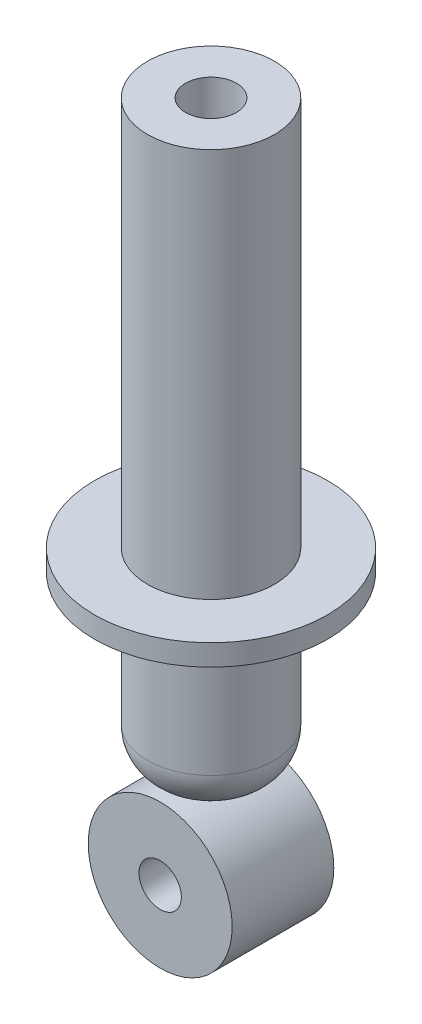
from build123d import *

# Parameters (mm, degrees)
SKETCH_1_R          = 15
EXTRUDE_1_DEPTH     = 136
SKETCH_2_R          = 15
SKETCH_2_R_2        = 6
EXTRUDE_2_DEPTH     = 2
CUT_EXTRUDE_START   = -130
SKETCH_3_R          = 6
CUT_EXTRUDE_1_DEPTH = 130
SKETCH_4_R          = 17
SKETCH_4_R_2        = 5
EXTRUDE_3_DEPTH     = 12
FILLET_1_R          = 10
SKETCH_6_R          = 27.5
SKETCH_6_R_2        = 15
EXTRUDE_4_DEPTH     = 5


with BuildPart() as part:
    # Эскиз1 → Бобышка-Вытянуть1 (new body)
    with BuildSketch(Plane(origin=(0, 0, 0), x_dir=(1, 0, 0), z_dir=(0, 1, 0))):
        Circle(SKETCH_1_R)
    extrude(amount=EXTRUDE_1_DEPTH)

    # Эскиз2 → Бобышка-Вытянуть2 (add)
    with BuildSketch(Plane(origin=(0, 136, 0), x_dir=(1, 0, 0), z_dir=(0, 1, 0))):
        Circle(SKETCH_2_R)
        Circle(SKETCH_2_R_2, mode=Mode.SUBTRACT)
    extrude(amount=EXTRUDE_2_DEPTH)

    # Эскиз3 → Вырез-Вытянуть1 (cut)
    with BuildSketch(Plane(origin=(0, 136, 0), x_dir=(1, 0, 0), z_dir=(0, 1, 0)).offset(CUT_EXTRUDE_START)):
        Circle(SKETCH_3_R)
    extrude(amount=CUT_EXTRUDE_1_DEPTH, mode=Mode.SUBTRACT)

    # Скругление1
    fillet_1_edges = [part.edges().sort_by_distance(p)[0] for p in [
        (-15, 0, 0),
    ]]
    fillet(fillet_1_edges, radius=FILLET_1_R)

    # Эскиз6 → Бобышка-Вытянуть4 (add)
    with BuildSketch(Plane(origin=(0, 41, 0), x_dir=(1, 0, 0), z_dir=(0, 1, 0))):
        Circle(SKETCH_6_R)
        Circle(SKETCH_6_R_2, mode=Mode.SUBTRACT)
    extrude(amount=EXTRUDE_4_DEPTH)


with BuildPart() as body_2:
    # Эскиз4 → Бобышка-Вытянуть3 (new, symmetric)
    with BuildSketch(Plane.XY):
        with Locations((0, -17)):
            Circle(SKETCH_4_R)
        with Locations((0, -17)):
            Circle(SKETCH_4_R_2, mode=Mode.SUBTRACT)
    extrude(amount=EXTRUDE_3_DEPTH, both=True)


solid = Compound([part.part, body_2.part])
